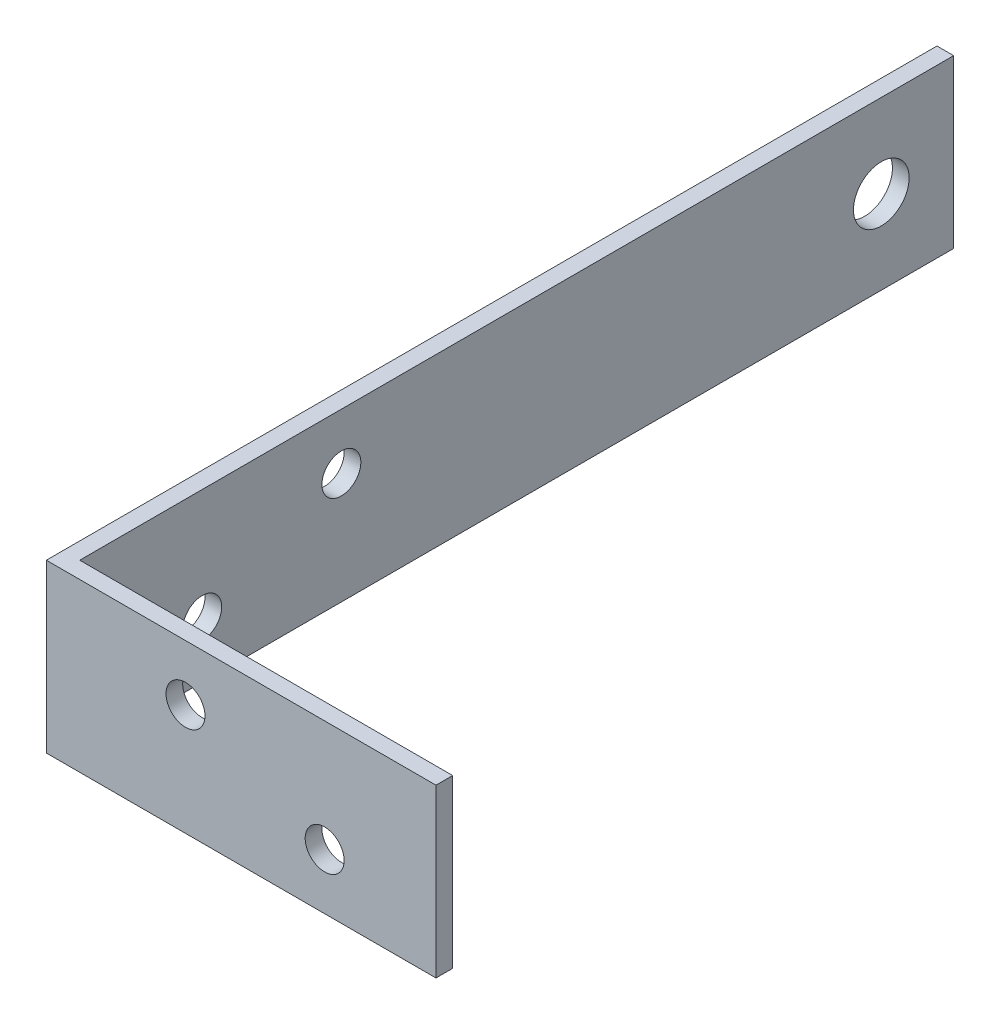
from build123d import *

# Parameters (mm, degrees)
EXTRUDE_1_DEPTH     = 30
SKETCH_2_R          = 3.5
CUT_EXTRUDE_1_DEPTH = 178.200451467
SKETCH_3_R          = 3.5
CUT_EXTRUDE_2_DEPTH = 178.200451467
SKETCH_4_R          = 5
CUT_EXTRUDE_3_DEPTH = 178.200451467


with BuildPart() as part:
    # Эскиз1 → Вытянуть-Тонкостенный1 (new body)
    with BuildSketch(Plane(origin=(0, 0, 0), x_dir=(1, 0, 0), z_dir=(0, 1, 0))):
        Polygon((0, 160), (0, 120), (0, 0), (70, 0), (70, 3), (3, 3), (3, 120), (3, 160), align=None)
    extrude(amount=EXTRUDE_1_DEPTH)

    # Эскиз2 → Вырез-Вытянуть1 (cut, through all)
    with BuildSketch(Plane.ZY):
        with Locations((-50, 20)):
            Circle(SKETCH_2_R)
        with Locations((-25, 10)):
            Circle(SKETCH_2_R)
    extrude(amount=-CUT_EXTRUDE_1_DEPTH, mode=Mode.SUBTRACT)

    # Эскиз3 → Вырез-Вытянуть2 (cut, through all)
    with BuildSketch(Plane.XY):
        with Locations((25, 20)):
            Circle(SKETCH_3_R)
        with Locations((50, 10)):
            Circle(SKETCH_3_R)
    extrude(amount=-CUT_EXTRUDE_2_DEPTH, mode=Mode.SUBTRACT)

    # Эскиз4 → Вырез-Вытянуть3 (cut, through all)
    with BuildSketch(Plane.ZY):
        with Locations((-147, 15)):
            Circle(SKETCH_4_R)
    extrude(amount=-CUT_EXTRUDE_3_DEPTH, mode=Mode.SUBTRACT)


solid = part.part
